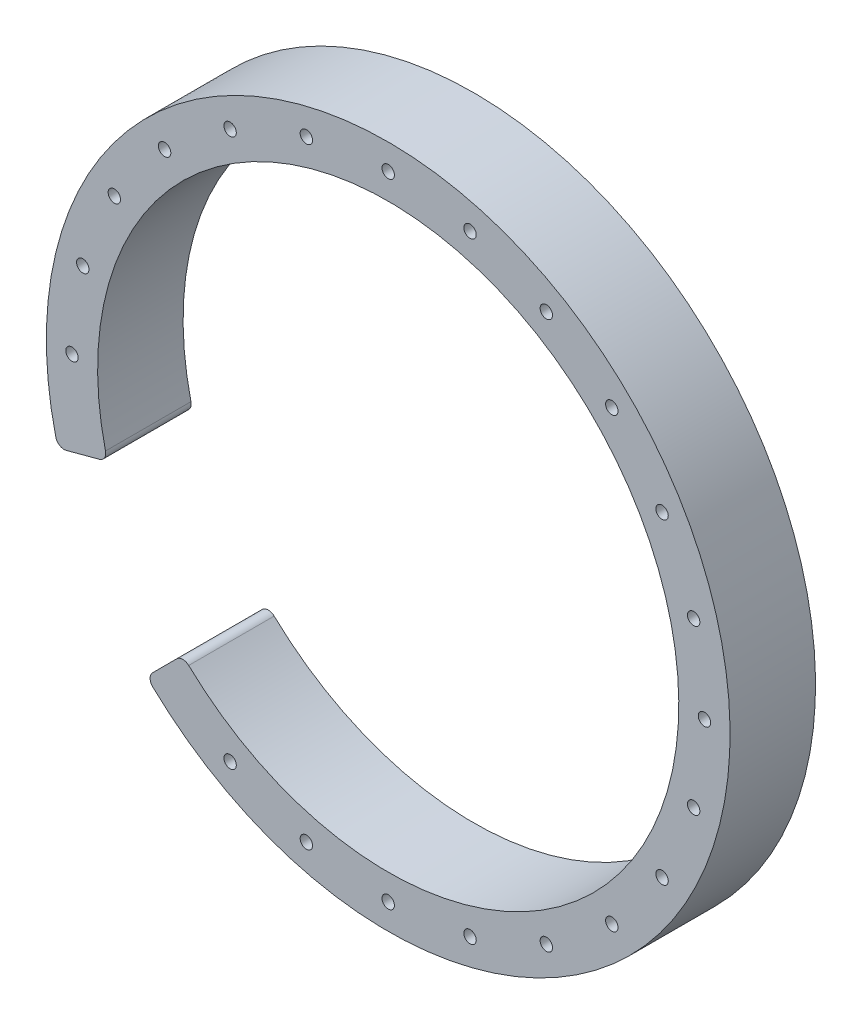
from build123d import *

# Parameters (mm, degrees)
SKETCH1_R           = 1.450000001
BOSS_EXTRUDE2_DEPTH = 20


with BuildPart() as part:
    # Sketch1 → Boss-Extrude2 (new body)
    with BuildSketch(Plane.XY):
        with BuildLine():
            Line((-22.940091219, -1.898220059), (-26.831398039, -2.940892579))
            Line((-26.831398039, -2.940892579), (-30.670329944, -3.969531283))
            ThreePointArc((-30.670329944, -3.969531283), (-32.210093439, -3.756766497), (-33.132457294, -2.505612871))
            ThreePointArc((-33.132457294, -2.505612871), (113.92914541, 56.211716755), (-10.452355043, -41.788702291))
            ThreePointArc((-10.452355043, -41.788702291), (-11.07470394, -40.364334948), (-10.489081902, -38.924478252))
            Line((-10.489081902, -38.924478252), (-7.6787887, -36.11418505))
            Line((-7.6787887, -36.11418505), (-4.830154401, -33.265550751))
            ThreePointArc((-4.830154401, -33.265550751), (-3.444515184, -32.679968447), (-2.042710726, -33.225721997))
            ThreePointArc((-2.042710726, -33.225721997), (103.536840564, 50.211716755), (-21.511876669, 0.495862598))
            ThreePointArc((-21.511876669, 0.495862598), (-21.740142459, -0.991012449), (-22.940091219, -1.898220059))
        make_face()
        with Locations((-26.831398039, 35.364326096)):
            Circle(SKETCH1_R, mode=Mode.SUBTRACT)
        with Locations((-19.438766774, 53.211716759)):
            Circle(SKETCH1_R, mode=Mode.SUBTRACT)
        with Locations((-29.352886893, 16.211716758)):
            Circle(SKETCH1_R, mode=Mode.SUBTRACT)
        with Locations((116.125624253, -2.940892579)):
            Circle(SKETCH1_R, mode=Mode.SUBTRACT)
        with Locations((108.732992988, -20.788283242)):
            Circle(SKETCH1_R, mode=Mode.SUBTRACT)
        with Locations((96.973014915, -36.114185049)):
            Circle(SKETCH1_R, mode=Mode.SUBTRACT)
        with Locations((81.647113106, -47.874163121)):
            Circle(SKETCH1_R, mode=Mode.SUBTRACT)
        with Locations((63.799722443, -55.266794386)):
            Circle(SKETCH1_R, mode=Mode.SUBTRACT)
        with Locations((44.647113106, -57.788283242)):
            Circle(SKETCH1_R, mode=Mode.SUBTRACT)
        with Locations((25.494503768, -55.266794386)):
            Circle(SKETCH1_R, mode=Mode.SUBTRACT)
        with Locations((7.647113108, -47.874163121)):
            Circle(SKETCH1_R, mode=Mode.SUBTRACT)
        with Locations((-7.678788702, 68.537618566)):
            Circle(SKETCH1_R, mode=Mode.SUBTRACT)
        with Locations((7.647113108, 80.297596638)):
            Circle(SKETCH1_R, mode=Mode.SUBTRACT)
        with Locations((25.494503768, 87.690227903)):
            Circle(SKETCH1_R, mode=Mode.SUBTRACT)
        with Locations((44.647113106, 90.211716759)):
            Circle(SKETCH1_R, mode=Mode.SUBTRACT)
        with Locations((63.799722443, 87.690227903)):
            Circle(SKETCH1_R, mode=Mode.SUBTRACT)
        with Locations((81.647113106, 80.297596638)):
            Circle(SKETCH1_R, mode=Mode.SUBTRACT)
        with Locations((96.973014915, 68.537618566)):
            Circle(SKETCH1_R, mode=Mode.SUBTRACT)
        with Locations((108.732992988, 53.211716759)):
            Circle(SKETCH1_R, mode=Mode.SUBTRACT)
        with Locations((116.125624253, 35.364326096)):
            Circle(SKETCH1_R, mode=Mode.SUBTRACT)
        with Locations((118.647113104, 16.211716758)):
            Circle(SKETCH1_R, mode=Mode.SUBTRACT)
    extrude(amount=BOSS_EXTRUDE2_DEPTH)


solid = part.part
